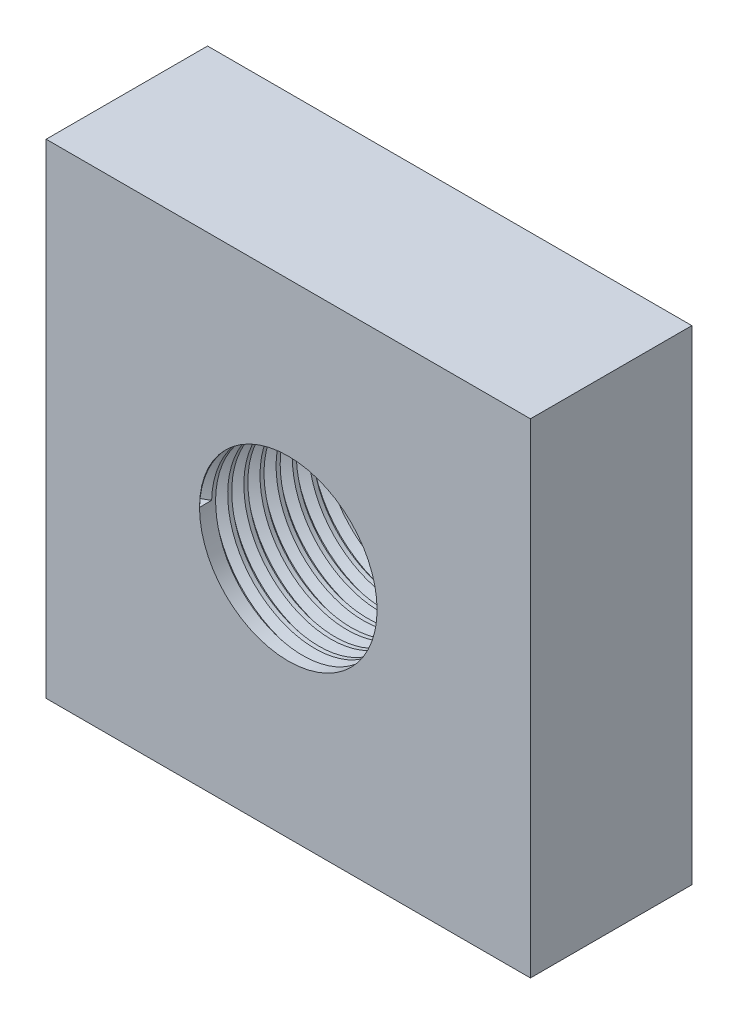
from build123d import *

# Parameters (mm, degrees)
SCHIZZO1_W                   = 30
SCHIZZO1_H                   = 30
ESTRUSIONE_ESTRUSIONE1_DEPTH = 10
FORO_PER_VITE_M10_1_D        = 11
FORO_PER_VITE_M10_1_DEPTH    = 15
FORO_PER_VITE_M10_1_TIP      = 3.304733405
FILETTATURA1_PITCH           = 1


with BuildPart() as part:
    # Schizzo1 → Estrusione-Estrusione1 (new body)
    with BuildSketch(Plane.XY):
        Rectangle(SCHIZZO1_W, SCHIZZO1_H)
    extrude(amount=ESTRUSIONE_ESTRUSIONE1_DEPTH)

    # Foro per Vite M10-1
    with Locations(Plane.XY.offset(10)):
        with Locations((0, 0)):
            Hole(FORO_PER_VITE_M10_1_D / 2, depth=FORO_PER_VITE_M10_1_DEPTH)
            with Locations((0, 0, -(FORO_PER_VITE_M10_1_DEPTH + FORO_PER_VITE_M10_1_TIP / 2))):  # 118° drill point
                Cone(0, FORO_PER_VITE_M10_1_D / 2, FORO_PER_VITE_M10_1_TIP, mode=Mode.SUBTRACT)

    # Filettatura1: the profile of Profilo filettatura1 profile screwed along a right-hand helix of 10 turns, 8 arcs to a turn; built about Z, then put on its axis
    filettatura1_z = Axis((0, 0, 0), (0, 0, 1))
    filettatura1_corners = [(5.4997, 0, -0.000173205), (6.041265875, 0, 0.312499999), (6.041265875, 0, 0.437499999), (5.4997, 0, 0.750173202)]
    with BuildLine(mode=Mode.PRIVATE) as filettatura1_profile:
        Line(filettatura1_corners[0], filettatura1_corners[1])
        Line(filettatura1_corners[1], filettatura1_corners[2])
        Line(filettatura1_corners[2], filettatura1_corners[3])
        Line(filettatura1_corners[3], filettatura1_corners[0])
    filettatura1_cap = Face(filettatura1_profile.wire())
    filettatura1_turn_angles = [0, 22.5, 45, 67.5, 90, 112.5, 135, 157.5, 180, 202.5, 225, 247.5, 270, 292.5, 315, 337.5, 360]
    filettatura1_turn_weights = [1, 0.9238795325112867, 1, 0.9238795325112867, 1, 0.9238795325112867, 1, 0.9238795325112867, 1, 0.9238795325112867, 1, 0.9238795325112867, 1, 0.9238795325112867, 1, 0.9238795325112867, 1]
    filettatura1_turn_rails = [Edge.make_bspline([Vector(p[0], p[1], 0).rotate(filettatura1_z, filettatura1_turn_angles[k]) / filettatura1_turn_weights[k] + Vector(0, 0, p[2] + FILETTATURA1_PITCH * filettatura1_turn_angles[k] / 360) for k in range(17)], [0, 0, 0, 1, 1, 2, 2, 3, 3, 4, 4, 5, 5, 6, 6, 7, 7, 8, 8, 8], 2, filettatura1_turn_weights) for p in filettatura1_corners]
    filettatura1_turn_sides = [Face.make_surface_from_curves(filettatura1_turn_rails[p[0]], filettatura1_turn_rails[p[1]]) for p in [(0, 1), (1, 2), (2, 3), (3, 0)]]
    filettatura1 = Plane(origin=(0, 0, 10), x_dir=(-1, 0, 0), z_dir=(0, 0, -1)) * Solid(Shell([*[p.moved(Location((0, 0, FILETTATURA1_PITCH * i))) for i in range(10) for p in filettatura1_turn_sides], filettatura1_cap, filettatura1_cap.rotate(filettatura1_z, 3600).moved(Location((0, 0, FILETTATURA1_PITCH * 3600 / 360)))]))
    add(filettatura1, mode=Mode.SUBTRACT)


solid = part.part
